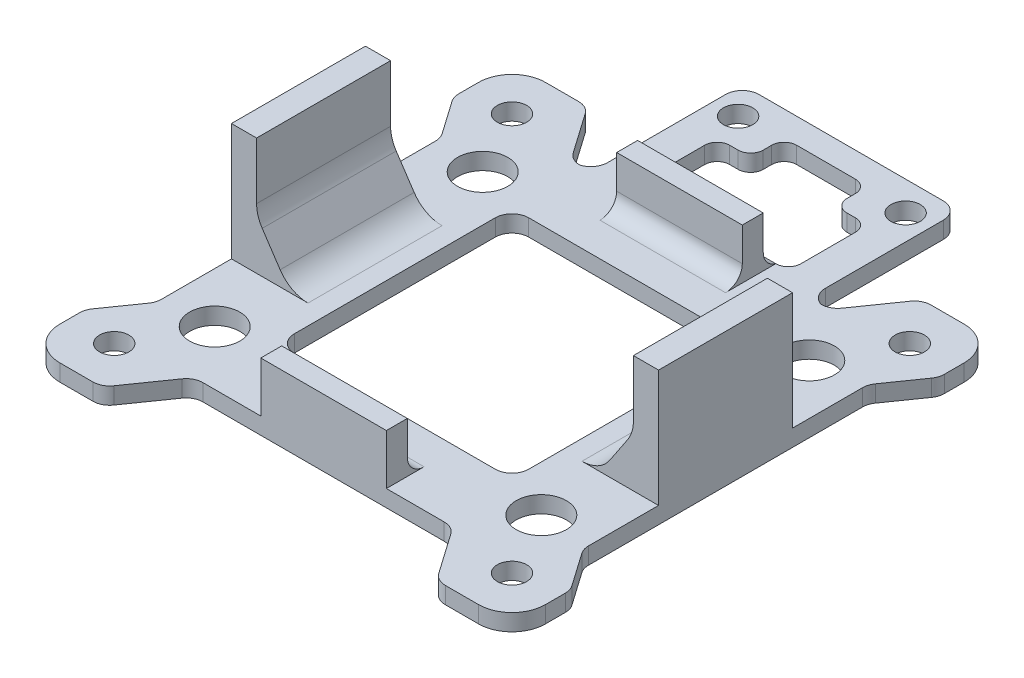
from build123d import *

# Parameters (mm, degrees)
SKETCH1_R              = 1.75
BOSS_EXTRUDE1_DEPTH    = 2
SKETCH2_W              = 7
SKETCH2_H              = 16
BOSS_EXTRUDE2_DEPTH    = 14
CUT_EXTRUDE1_DEPTH     = 50.658836072
SKETCH5_W              = 15
SKETCH5_H              = 2.5
BOSS_EXTRUDE3_DEPTH    = 6
CUT_EXTRUDE2_DEPTH     = 44.33589736
FILLET2_R              = 2
SKETCH7_R              = 3
CUT_EXTRUDE3_DEPTH     = 44.33589736
SKETCH8_W              = 26
SKETCH8_H              = 18
SKETCH8_R              = 1.75
PINOUT_BD_HOLDER_DEPTH = 2
WEIGH_REDUCER_DEPTH    = 53.318734694
FILLET3_R              = 4
FILLET4_R              = 2
FILLET5_DEPTH          = 2
FILLET5_START          = -7.5
FILLET5_2_DEPTH        = 15
FILLET5_START_2        = -1
FILLET5_3_DEPTH        = 4


with BuildPart() as part:
    # Sketch1 → Boss-Extrude1 (new body)
    with BuildSketch(Plane(origin=(0, 0, 0), x_dir=(1, 0, 0), z_dir=(0, 1, 0))):
        with BuildLine():
            Line((-25, 29), (25, 29))
            ThreePointArc((25, 29), (27.828427125, 27.828427125), (29, 25))
            Line((29, 25), (29, -25))
            ThreePointArc((29, -25), (27.828427125, -27.828427125), (25, -29))
            Line((25, -29), (-25, -29))
            ThreePointArc((-25, -29), (-27.828427125, -27.828427125), (-29, -25))
            Line((-29, -25), (-29, 25))
            ThreePointArc((-29, 25), (-27.828427125, 27.828427125), (-25, 29))
        make_face()
        with Locations(Location((23.75, 23.75, 0), (0, 0, 270))):
            Circle(SKETCH1_R, mode=Mode.SUBTRACT)
        with Locations(Location((23.75, -23.75, 0), (0, 0, 270))):
            Circle(SKETCH1_R, mode=Mode.SUBTRACT)
        with Locations(Location((-23.75, -23.75, 0), (0, 0, 270))):
            Circle(SKETCH1_R, mode=Mode.SUBTRACT)
        with Locations(Location((-23.75, 23.75, 0), (0, 0, 270))):
            Circle(SKETCH1_R, mode=Mode.SUBTRACT)
        with BuildLine():
            Line((-12, 14), (12, 14))
            ThreePointArc((12, 14), (13.414213562, 13.414213562), (14, 12))
            Line((14, 12), (14, -12))
            ThreePointArc((14, -12), (13.414213562, -13.414213562), (12, -14))
            Line((12, -14), (-12, -14))
            ThreePointArc((-12, -14), (-13.414213562, -13.414213562), (-14, -12))
            Line((-14, -12), (-14, 12))
            ThreePointArc((-14, 12), (-13.414213562, 13.414213562), (-12, 14))
        make_face(mode=Mode.SUBTRACT)
    extrude(amount=BOSS_EXTRUDE1_DEPTH)

    # Sketch2 → Boss-Extrude2 (add)
    with BuildSketch(Plane(origin=(0, 2, 0), x_dir=(1, 0, 0), z_dir=(0, 1, 0))):
        with Locations((-22, 0)):
            Rectangle(SKETCH2_W, SKETCH2_H)
        with Locations((22, 0)):
            Rectangle(SKETCH2_W, SKETCH2_H)
    extrude(amount=BOSS_EXTRUDE2_DEPTH)

    # Sketch4 → Cut-Extrude1 (cut, through all)
    with BuildSketch(Plane.XY.offset(8)):
        Polygon((-18.5, 16), (-22.5, 16), (-22.5, 8), (-18.5, 2), align=None)
        Polygon((18.5, 2), (18.5, 16), (22.5, 16), (22.5, 8), align=None)
    extrude(amount=-CUT_EXTRUDE1_DEPTH, mode=Mode.SUBTRACT)

    # Sketch5 → Boss-Extrude3 (add)
    with BuildSketch(Plane(origin=(0, 2, 0), x_dir=(1, 0, 0), z_dir=(0, 1, 0))):
        with Locations((0, 21.25)):
            Rectangle(SKETCH5_W, SKETCH5_H)
        with Locations((0, -21.25)):
            Rectangle(SKETCH5_W, SKETCH5_H)
    extrude(amount=BOSS_EXTRUDE3_DEPTH)

    # Sketch6 → Cut-Extrude2 (cut, through all)
    with BuildSketch(Plane(origin=(0, 2, 0), x_dir=(1, 0, 0), z_dir=(0, 1, 0))):
        Polygon((-25.5, 8), (-25.5, 17), (-29, 22), (-29, -22), (-25.5, -17), (-25.5, -8), align=None)
        Polygon((-15.45, -22.5), (-7.5, -22.5), (7.5, -22.5), (15.45, -22.5), (20, -29), (-20, -29), align=None)
        Polygon((29, 22), (29, -22), (25.5, -17), (25.5, -8), (25.5, 8), (25.5, 17), align=None)
        Polygon((-7.5, 22.5), (7.5, 22.5), (15.45, 22.5), (20, 29), (-20, 29), (-15.45, 22.5), align=None)
    extrude(amount=-CUT_EXTRUDE2_DEPTH, mode=Mode.SUBTRACT)

    # Fillet2
    fillet2_edges = [part.edges().sort_by_distance(p)[0] for p in [
        (-25.5, 1, -17),
        (-25.5, 1, 17),
        (-29, 1, 22),
        (-29, 1, -22),
        (-20, 1, 29),
        (-15.45, 1, 22.5),
        (15.45, 1, 22.5),
        (20, 1, 29),
        (25.5, 1, -17),
        (29, 1, -22),
        (29, 1, 22),
        (25.5, 1, 17),
        (-15.45, 1, -22.5),
        (-20, 1, -29),
        (20, 1, -29),
        (15.45, 1, -22.5),
    ]]
    fillet(fillet2_edges, radius=FILLET2_R)

    # Sketch7 → Cut-Extrude3 (cut, through all)
    with BuildSketch(Plane(origin=(0, 2, 0), x_dir=(1, 0, 0), z_dir=(0, 1, 0))):
        with Locations(Location((19.5, 16, 0), (0, 0, 270))):
            Circle(SKETCH7_R)
        with Locations(Location((19.5, -16, 0), (0, 0, 90))):
            Circle(SKETCH7_R)
        with Locations(Location((-19.5, -16, 0), (0, 0, 270))):
            Circle(SKETCH7_R)
        with Locations(Location((-19.5, 16, 0), (0, 0, 90))):
            Circle(SKETCH7_R)
    extrude(amount=-CUT_EXTRUDE3_DEPTH, mode=Mode.SUBTRACT)

    # Sketch8 → pinout_bd_holder (add)
    with BuildSketch(Plane(origin=(0, 2, 0), x_dir=(1, 0, 0), z_dir=(0, 1, 0))):
        with Locations((0, 31.5)):
            Rectangle(SKETCH8_W, SKETCH8_H)
        with Locations(Location((-10, 37, 0), (0, 0, 270))):
            Circle(SKETCH8_R, mode=Mode.SUBTRACT)
        with Locations(Location((10, 37, 0), (0, 0, 90))):
            Circle(SKETCH8_R, mode=Mode.SUBTRACT)
    extrude(amount=-PINOUT_BD_HOLDER_DEPTH)

    # Sketch9 → Weigh-Reducer (cut, through all)
    with BuildSketch(Plane.XZ):
        with BuildLine():
            Line((-7.5, -24), (7.5, -24))
            ThreePointArc((7.5, -24), (8.560660172, -24.439339828), (9, -25.5))
            Line((9, -25.5), (9, -32))
            ThreePointArc((9, -32), (8.560660172, -33.060660172), (7.5, -33.5))
            Line((7.5, -33.5), (6.5, -33.5))
            ThreePointArc((6.5, -33.5), (5.439339828, -33.939339828), (5, -35))
            Line((5, -35), (5, -36))
            ThreePointArc((5, -36), (4.560660172, -37.060660172), (3.5, -37.5))
            Line((3.5, -37.5), (-3.5, -37.5))
            ThreePointArc((-3.5, -37.5), (-4.560660172, -37.060660172), (-5, -36))
            Line((-5, -36), (-5, -35))
            ThreePointArc((-5, -35), (-5.439339828, -33.939339828), (-6.5, -33.5))
            Line((-6.5, -33.5), (-7.5, -33.5))
            ThreePointArc((-7.5, -33.5), (-8.560660172, -33.060660172), (-9, -32))
            Line((-9, -32), (-9, -25.5))
            ThreePointArc((-9, -25.5), (-8.560660172, -24.439339828), (-7.5, -24))
        make_face()
    extrude(amount=-WEIGH_REDUCER_DEPTH, mode=Mode.SUBTRACT)

    # Fillet3
    fillet3_edges = [part.edges().sort_by_distance(p)[0] for p in [
        (22.5, 8, 0),
        (-18.5, 2, 0),
        (18.5, 2, 0),
        (-22.5, 8, 0),
    ]]
    fillet(fillet3_edges, radius=FILLET3_R)

    # Fillet4
    fillet4_edges = [part.edges().sort_by_distance(p)[0] for p in [
        (0, 2, -20),
        (0, 2, 20),
    ]]
    fillet(fillet4_edges, radius=FILLET4_R)

    # Fillet5: read off the stored shape, not the designer's step
    # Fillet5 outline → Fillet5 (add)
    with BuildSketch(Plane(origin=(0, 0, 0), x_dir=(1, 0, 0), z_dir=(0, 1, 0))):
        with BuildLine():
            Line((-13, 22.5), (-13, 24.410589217))
            ThreePointArc((-13, 24.410589217), (-13.390245011, 23.223707219), (-14.408688877, 22.5))
            Line((-14.408688877, 22.5), (-13, 22.5))
        make_face()
        with BuildLine():
            ThreePointArc((14.408688877, 22.5), (13.390245011, 23.223707219), (13, 24.410589217))
            Line((13, 24.410589217), (13, 22.5))
            Line((13, 22.5), (14.408688877, 22.5))
        make_face()
    extrude(amount=FILLET5_DEPTH)

    # Fillet5 2 outline → Fillet5 2 (add)
    with BuildSketch(Plane.YZ.offset(FILLET5_START)):
        with BuildLine():
            ThreePointArc((2, -24), (2.711746802, -22.91886117), (3.936491673, -22.5))
            Line((3.936491673, -22.5), (2, -22.5))
            Line((2, -22.5), (2, -24))
        make_face()
    extrude(amount=FILLET5_2_DEPTH)

    # Fillet5 3 outline → Fillet5 3 (cut)
    with BuildSketch(Plane(origin=(0, 0, 0), x_dir=(1, 0, 0), z_dir=(0, 1, 0)).offset(FILLET5_START_2)):
        with BuildLine():
            ThreePointArc((-13, 38.5), (-12.414213562, 39.914213562), (-11, 40.5))
            Line((-11, 40.5), (-13, 40.5))
            Line((-13, 40.5), (-13, 38.5))
        make_face()
        with BuildLine():
            ThreePointArc((11, 40.5), (12.414213562, 39.914213562), (13, 38.5))
            Line((13, 38.5), (13, 40.5))
            Line((13, 40.5), (11, 40.5))
        make_face()
    extrude(amount=FILLET5_3_DEPTH, mode=Mode.SUBTRACT)


solid = part.part
